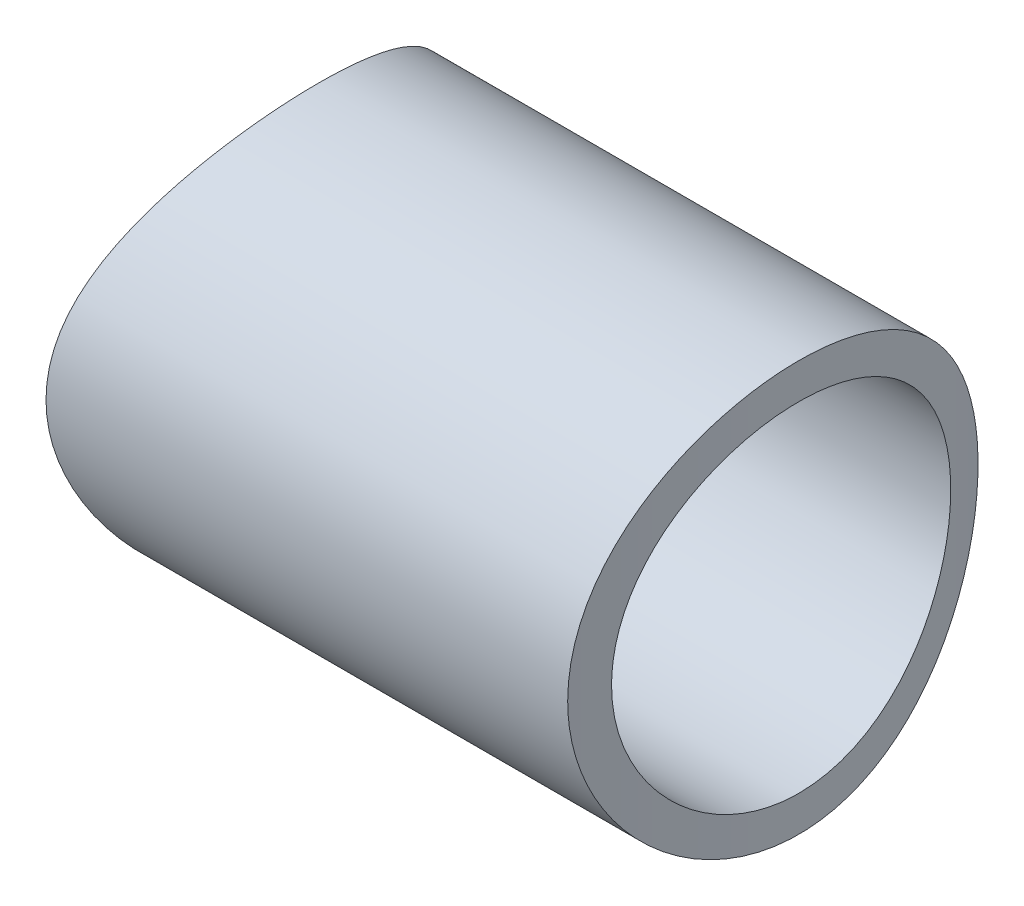
from build123d import *

# Parameters (mm, degrees)
SKETCH1_R                = 46.53
SKETCH1_R_2              = 19.53
BOSS_EXTRUDE1_DEPTH      = 1
SKETCH2_R                = 46.53
SKETCH2_R_2              = 45.53
SKETCH2_R_3              = 20.53
SKETCH2_R_4              = 19.53
BOSS_EXTRUDE2_DEPTH      = 25
SKETCH3_R                = 9.53
CUT_EXTRUDE1_DEPTH       = 71.753669869
BOSS_EXTRUDE3_REACH      = 72.754
BOSS_EXTRUDE3_END_RADIUS = 46.53
SKETCH9_R                = 11.53
SKETCH9_R_2              = 9.53
CUT_EXTRUDE2_DEPTH       = 71.950142522
CUT_EXTRUDE2_DEPTH_BACK  = 71.950142522
CUT_EXTRUDE4_DEPTH       = 57.734180376
CUT_EXTRUDE4_DEPTH_BACK  = 57.734180376
SKETCH11_R               = 50
SKETCH11_R_2             = 11.53


with BuildPart() as part:
    # Sketch1 → Boss-Extrude1 (new body)
    with BuildSketch(Plane(origin=(0, 0, 0), x_dir=(1, 0, 0), z_dir=(0, 1, 0))):
        Circle(SKETCH1_R)
        Circle(SKETCH1_R_2, mode=Mode.SUBTRACT)
    extrude(amount=BOSS_EXTRUDE1_DEPTH)

    # Sketch2 → Boss-Extrude2 (add)
    # profile 1 of 2: a face of its own
    with BuildSketch(Plane(origin=(0, 1, 0), x_dir=(1, 0, 0), z_dir=(0, 1, 0))):
        Circle(SKETCH2_R)
        Circle(SKETCH2_R_2, mode=Mode.SUBTRACT)
    # profile 2 of 2: a face of its own
    with BuildSketch(Plane(origin=(0, 1, 0), x_dir=(1, 0, 0), z_dir=(0, 1, 0))):
        Circle(SKETCH2_R_3)
        Circle(SKETCH2_R_4, mode=Mode.SUBTRACT)
    extrude(amount=BOSS_EXTRUDE2_DEPTH)

    # Sketch3 → Cut-Extrude1 (cut, through all)
    with BuildSketch(Plane(origin=(0, 0, 0), x_dir=(0, 0, -1), z_dir=(1, 0, 0))):
        with Locations((0, 11)):
            Circle(SKETCH3_R)
    extrude(amount=CUT_EXTRUDE1_DEPTH, mode=Mode.SUBTRACT)

    # Boss-Extrude3: up to this cylinder (the profile starts inside it)
    boss_extrude3_end = Plane(origin=(0, 11, 0), z_dir=(0, -1, 0)) * Cylinder(BOSS_EXTRUDE3_END_RADIUS, 239.568, mode=Mode.PRIVATE)
    # Sketch9 → Boss-Extrude3 (add, up to the surface)
    with BuildSketch(Plane(origin=(0, 0, 0), x_dir=(0, 0, -1), z_dir=(1, 0, 0)), mode=Mode.PRIVATE) as boss_extrude3_sk1:
        with Locations((0, 11)):
            Circle(SKETCH9_R)
        with Locations((0, 11)):
            Circle(SKETCH9_R_2, mode=Mode.SUBTRACT)
    boss_extrude3_tool1 = extrude(boss_extrude3_sk1.sketch, amount=BOSS_EXTRUDE3_REACH, mode=Mode.PRIVATE) & boss_extrude3_end
    add(boss_extrude3_tool1.solids().sort_by_distance((0, 11, 11.203882))[0])

    # Sketch10 → Cut-Extrude2 (cut, two sides: drawn at the far end of the back side and taken through both)
    with BuildSketch(Plane(origin=(0, 26, 0), x_dir=(1, 0, 0), z_dir=(0, 1, 0)).offset(-CUT_EXTRUDE2_DEPTH_BACK)):
        with BuildLine():
            ThreePointArc((1.92213304, -19.435182134), (19.53, 0), (1.92213304, 19.435182134))
            Line((1.92213304, 19.435182134), (43.950018344, 15.278638275))
            ThreePointArc((43.950018344, 15.278638275), (-46.53, 0), (43.950018344, -15.278638275))
            Line((43.950018344, -15.278638275), (1.92213304, -19.435182134))
        make_face()
    extrude(amount=CUT_EXTRUDE2_DEPTH + CUT_EXTRUDE2_DEPTH_BACK, mode=Mode.SUBTRACT)

    # Sketch11 → Cut-Extrude4 (cut, two sides: drawn at the far end of the back side and taken through both)
    with BuildSketch(Plane(origin=(0, 0, 0), x_dir=(0, 0, -1), z_dir=(1, 0, 0)).offset(-CUT_EXTRUDE4_DEPTH_BACK)):
        with Locations((0, 11)):
            Circle(SKETCH11_R)
        with Locations((0, 11)):
            Circle(SKETCH11_R_2, mode=Mode.SUBTRACT)
    extrude(amount=CUT_EXTRUDE4_DEPTH + CUT_EXTRUDE4_DEPTH_BACK, mode=Mode.SUBTRACT)


solid = part.part
